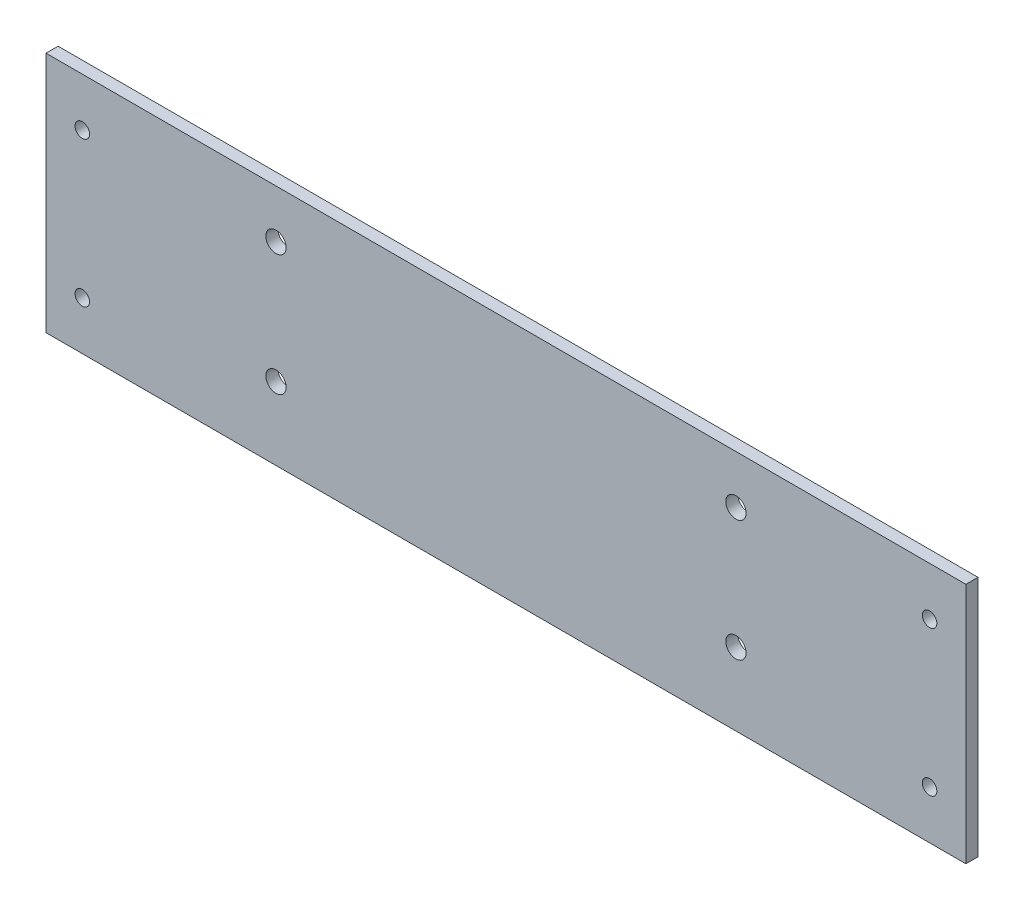
from build123d import *

# Parameters (mm, degrees)
SKETCH1_W           = 190
SKETCH1_H           = 50
BOSS_EXTRUDE1_DEPTH = 2.5
SKETCH2_R           = 1.5
CUT_EXTRUDE1_DEPTH  = 137.555862265
SKETCH3_R           = 2.1
CUT_EXTRUDE2_DEPTH  = 137.555862265


with BuildPart() as part:
    # Sketch1 → Boss-Extrude1 (new body)
    with BuildSketch(Plane.XY):
        with Locations((-34.225888325, 19.067258883)):
            Rectangle(SKETCH1_W, SKETCH1_H)
    extrude(amount=BOSS_EXTRUDE1_DEPTH)

    # Sketch2 → Cut-Extrude1 (cut, through all)
    with BuildSketch(Plane.XY.offset(2.5)):
        with Locations((-121.725888325, 34.067258883)):
            Circle(SKETCH2_R)
        with Locations((-121.725888325, 4.067258883)):
            Circle(SKETCH2_R)
        with Locations((53.274111675, 34.067258883)):
            Circle(SKETCH2_R)
        with Locations((53.274111675, 4.067258883)):
            Circle(SKETCH2_R)
    extrude(amount=-CUT_EXTRUDE1_DEPTH, mode=Mode.SUBTRACT)

    # Sketch3 → Cut-Extrude2 (cut, through all)
    with BuildSketch(Plane.XY.offset(2.5)):
        with Locations((-81.725888325, 34.067258883)):
            Circle(SKETCH3_R)
        with Locations((13.274111675, 34.067258883)):
            Circle(SKETCH3_R)
        with Locations((13.274111675, 9.067258883)):
            Circle(SKETCH3_R)
        with Locations((-81.725888325, 9.067258883)):
            Circle(SKETCH3_R)
    extrude(amount=-CUT_EXTRUDE2_DEPTH, mode=Mode.SUBTRACT)


solid = part.part
